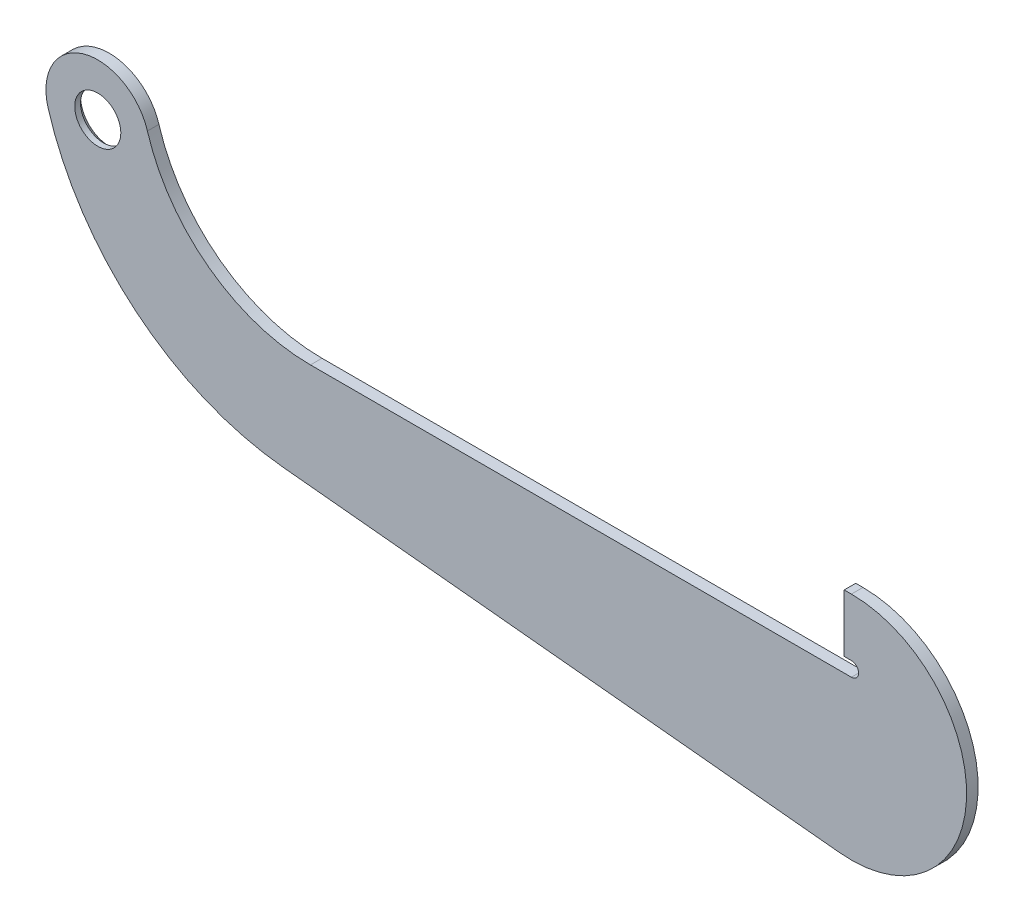
from build123d import *

# Parameters (mm, degrees)
SKETCH_1_R             = 8
SM_BASE_FLANGE_1_DEPTH = 4
CHAMFER_2_SIZE         = 2


# Sheet-metal steps are written as plain solids
with BuildPart() as part:
    # Sketch 1 → Базовая кромка1 (new body)
    with BuildSketch(Plane.XY):
        with BuildLine():
            Line((259.153254995, -11.814954576), (261.653254995, -11.814954576))
            ThreePointArc((261.653254995, -11.814954576), (301.603884083, -53.801719646), (257.684629276, -91.617592804))
            Line((257.684629276, -91.617592804), (64.398882219, -72.345533941))
            ThreePointArc((64.398882219, -72.345533941), (13.404361157, -51.155129463), (-17.229741187, -5.209224379))
            ThreePointArc((-17.229741187, -5.209224379), (-5.209224379, 17.229741187), (17.229741187, 5.209224379))
            ThreePointArc((17.229741187, 5.209224379), (38.587121714, -25.160558799), (73.838171235, -36.814954576))
            Line((73.838171235, -36.814954576), (261.653254995, -36.814954576))
            ThreePointArc((261.653254995, -36.814954576), (264.153254995, -34.314954576), (261.653254995, -31.814954576))
            Line((261.653254995, -31.814954576), (259.153254995, -31.814954576))
            Line((259.153254995, -31.814954576), (259.153254995, -11.814954576))
        make_face()
        Circle(SKETCH_1_R, mode=Mode.SUBTRACT)
    extrude(amount=SM_BASE_FLANGE_1_DEPTH)

    # Фаска2
    chamfer_2_edges = [part.edges().sort_by_distance(p)[0] for p in [
        (-8, 0, 0),
    ]]
    chamfer(chamfer_2_edges, length=CHAMFER_2_SIZE)


solid = part.part
